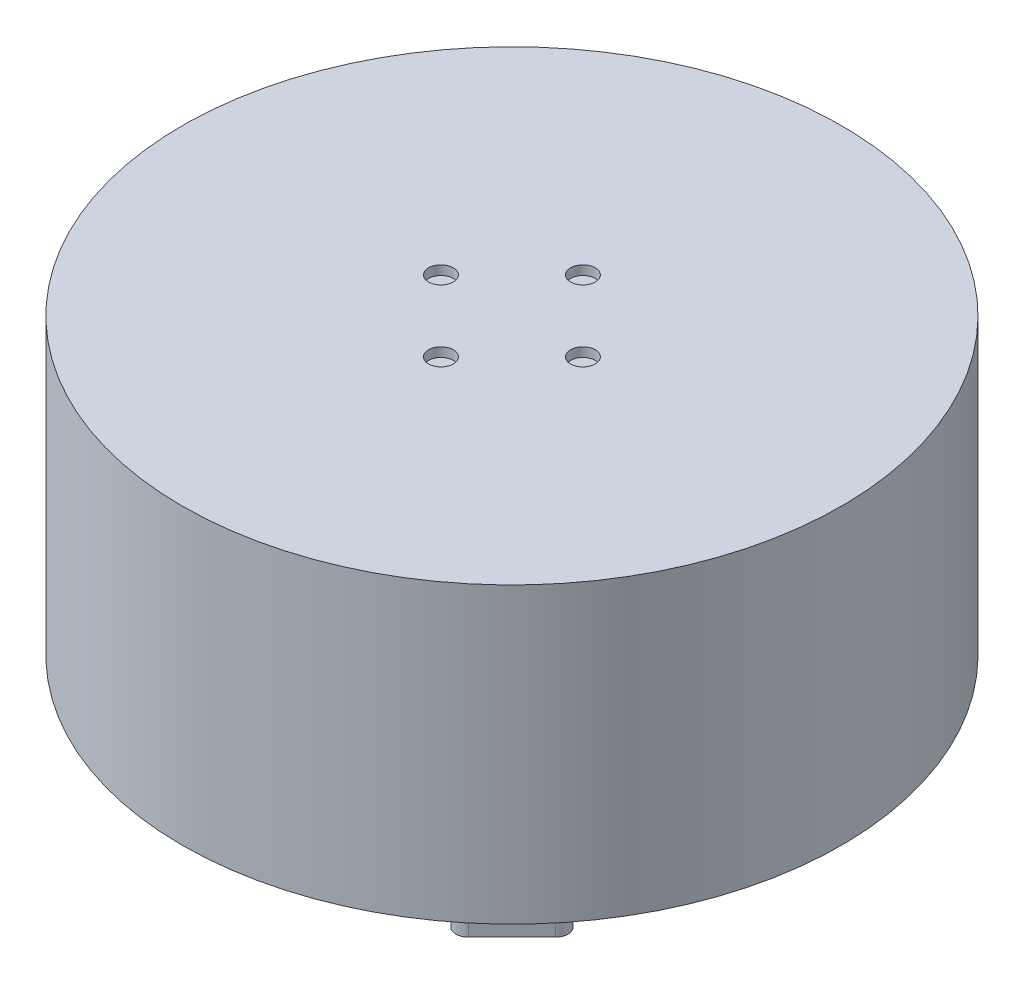
from build123d import *

# Parameters (mm, degrees)
SKETCH1_R           = 53.4
BOSS_EXTRUDE1_DEPTH = 47.6
SKETCH2_R           = 2.5
CUT_EXTRUDE1_DEPTH  = 1.5
BOSS_EXTRUDE2_DEPTH = 6
SKETCH4_R           = 2
CUT_EXTRUDE2_DEPTH  = 1.5


with BuildPart() as part:
    # Sketch1 → Boss-Extrude1 (new body)
    with BuildSketch(Plane(origin=(0, 0, 0), x_dir=(1, 0, 0), z_dir=(0, 1, 0))):
        Circle(SKETCH1_R)
    extrude(amount=BOSS_EXTRUDE1_DEPTH)

    # Sketch2 → Cut-Extrude1 (cut)
    with BuildSketch(Plane.XZ):
        with Locations((0, 20)):
            Circle(SKETCH2_R)
        with Locations((20, 0)):
            Circle(SKETCH2_R)
        with Locations((0, -20)):
            Circle(SKETCH2_R)
        with Locations((-20, 0)):
            Circle(SKETCH2_R)
    extrude(amount=-CUT_EXTRUDE1_DEPTH, mode=Mode.SUBTRACT)

    # Sketch3 → Boss-Extrude2 (add)
    with BuildSketch(Plane.XZ):
        with BuildLine():
            Line((30.0520382, 37.123106012), (37.123106012, 30.0520382))
            ThreePointArc((37.123106012, 30.0520382), (37.123106012, 27.223611076), (34.294678888, 27.223611076))
            Line((34.294678888, 27.223611076), (27.223611076, 34.294678888))
            ThreePointArc((27.223611076, 34.294678888), (27.223611076, 37.123106012), (30.0520382, 37.123106012))
        make_face()
    extrude(amount=BOSS_EXTRUDE2_DEPTH)

    # Sketch4 → Cut-Extrude2 (cut)
    with BuildSketch(Plane(origin=(0, 47.6, 0), x_dir=(1, 0, 0), z_dir=(0, 1, 0))):
        with Locations((0, 11.5)):
            Circle(SKETCH4_R)
        with Locations((11.5, 0)):
            Circle(SKETCH4_R)
        with Locations((0, -11.5)):
            Circle(SKETCH4_R)
        with Locations((-11.5, 0)):
            Circle(SKETCH4_R)
    extrude(amount=-CUT_EXTRUDE2_DEPTH, mode=Mode.SUBTRACT)


solid = part.part
